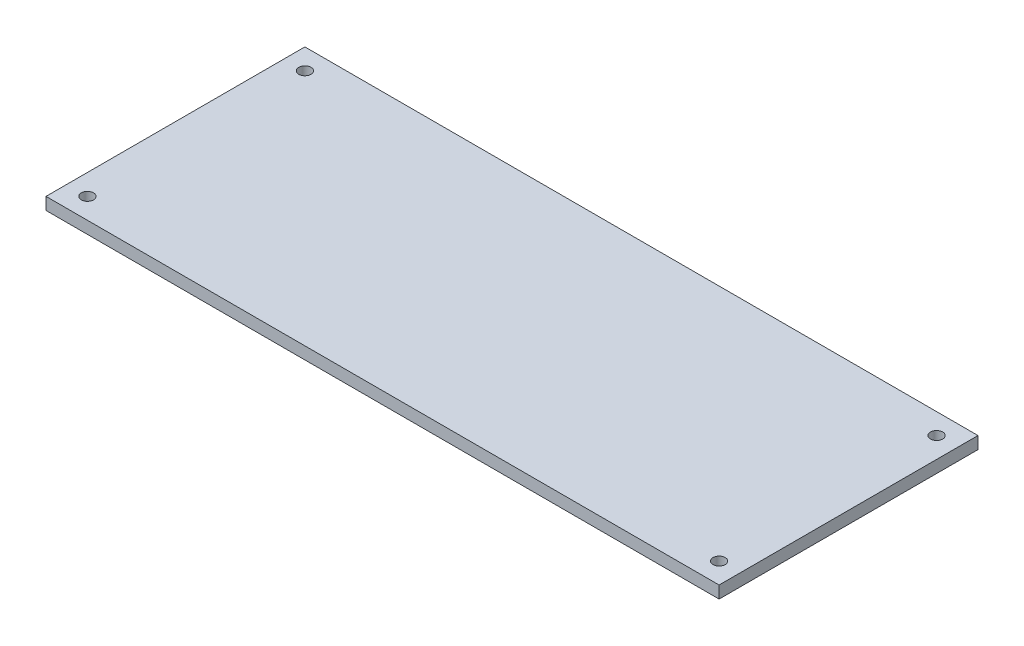
from build123d import *

# Parameters (mm, degrees)
SKETCH1_W           = 165.1
SKETCH1_H           = 63.5
BOSS_EXTRUDE1_DEPTH = 3
CUT_EXTRUDE1_REACH  = 90.496
SKETCH2_R           = 1.5


with BuildPart() as part:
    # Sketch1 → Boss-Extrude1 (new body)
    with BuildSketch(Plane(origin=(0, 0, 0), x_dir=(1, 0, 0), z_dir=(0, 1, 0))):
        Rectangle(SKETCH1_W, SKETCH1_H)
    extrude(amount=BOSS_EXTRUDE1_DEPTH)

    # Sketch2 → Cut-Extrude1 (cut, up to next)
    with BuildSketch(Plane(origin=(0, 3, 0), x_dir=(1, 0, 0), z_dir=(0, 1, 0)), mode=Mode.PRIVATE) as cut_extrude1_sk1:
        with Locations((-77.47, 26.67)):
            Circle(SKETCH2_R)
    cut_extrude1_tool1 = extrude(cut_extrude1_sk1.sketch, amount=-CUT_EXTRUDE1_REACH, mode=Mode.PRIVATE) & part.part
    # Sketch2 → Cut-Extrude1 (cut, up to next)
    with BuildSketch(Plane(origin=(0, 3, 0), x_dir=(1, 0, 0), z_dir=(0, 1, 0)), mode=Mode.PRIVATE) as cut_extrude1_sk2:
        with Locations((-77.47, -26.67)):
            Circle(SKETCH2_R)
    cut_extrude1_tool2 = extrude(cut_extrude1_sk2.sketch, amount=-CUT_EXTRUDE1_REACH, mode=Mode.PRIVATE) & part.part
    # Sketch2 → Cut-Extrude1 (cut, up to next)
    with BuildSketch(Plane(origin=(0, 3, 0), x_dir=(1, 0, 0), z_dir=(0, 1, 0)), mode=Mode.PRIVATE) as cut_extrude1_sk3:
        with Locations((77.47, 26.67)):
            Circle(SKETCH2_R)
    cut_extrude1_tool3 = extrude(cut_extrude1_sk3.sketch, amount=-CUT_EXTRUDE1_REACH, mode=Mode.PRIVATE) & part.part
    # Sketch2 → Cut-Extrude1 (cut, up to next)
    with BuildSketch(Plane(origin=(0, 3, 0), x_dir=(1, 0, 0), z_dir=(0, 1, 0)), mode=Mode.PRIVATE) as cut_extrude1_sk4:
        with Locations((77.47, -26.67)):
            Circle(SKETCH2_R)
    cut_extrude1_tool4 = extrude(cut_extrude1_sk4.sketch, amount=-CUT_EXTRUDE1_REACH, mode=Mode.PRIVATE) & part.part
    add(cut_extrude1_tool1.solids().sort_by_distance((-77.47, 3, -26.67))[0], mode=Mode.SUBTRACT)
    add(cut_extrude1_tool2.solids().sort_by_distance((-77.47, 3, 26.67))[0], mode=Mode.SUBTRACT)
    add(cut_extrude1_tool3.solids().sort_by_distance((77.47, 3, -26.67))[0], mode=Mode.SUBTRACT)
    add(cut_extrude1_tool4.solids().sort_by_distance((77.47, 3, 26.67))[0], mode=Mode.SUBTRACT)


solid = part.part
